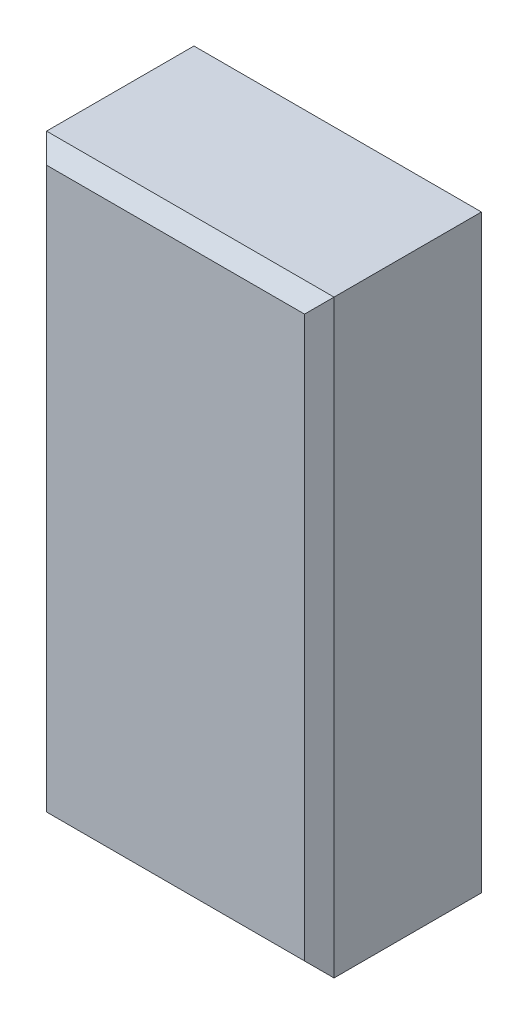
from build123d import *

# Parameters (mm, degrees)
SKETCH1_W           = 19.5
SKETCH1_H           = 40
BOSS_EXTRUDE1_DEPTH = 11
CHAMFER1_SIZE       = 1


with BuildPart() as part:
    # Sketch1 → Boss-Extrude1 (new body)
    with BuildSketch(Plane.XY):
        Rectangle(SKETCH1_W, SKETCH1_H)
    extrude(amount=BOSS_EXTRUDE1_DEPTH)

    # Chamfer1
    chamfer1_edges = [part.edges().sort_by_distance(p)[0] for p in [
        (0, -20, 11),
        (-9.75, 0, 11),
        (0, 20, 11),
        (9.75, 0, 11),
    ]]
    chamfer(chamfer1_edges, length=CHAMFER1_SIZE)


solid = part.part
